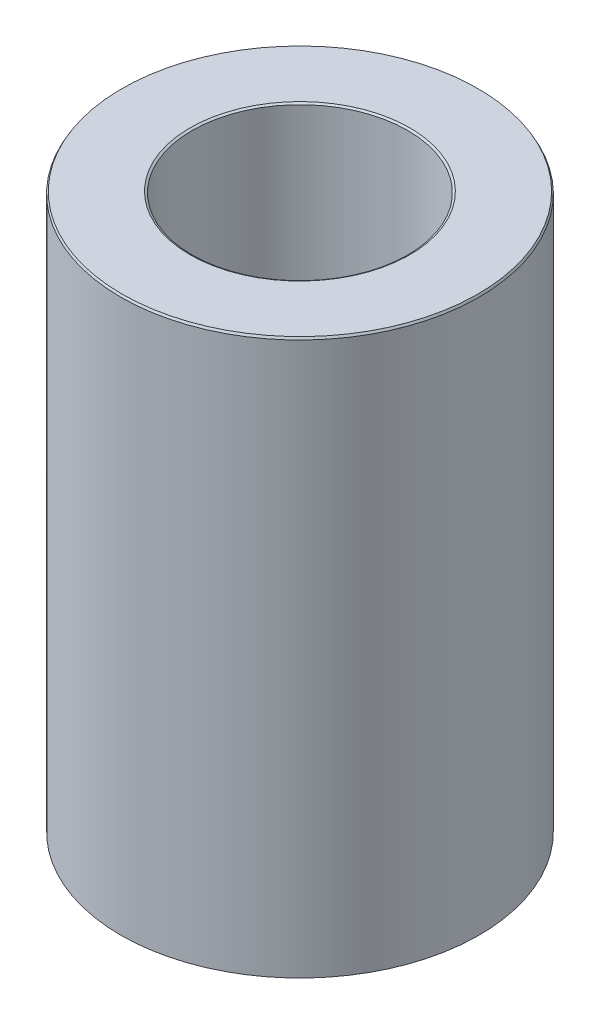
from build123d import *
from OCP.BRepFilletAPI import BRepFilletAPI_MakeChamfer

# Parameters (mm, degrees)
SKETCH1_R           = 25
BOSS_EXTRUDE1_DEPTH = 77.554585152
SKETCH2_R           = 15.04358838
CUT_EXTRUDE1_DEPTH  = 86.23328973
CHAMFER1_SIZE       = 0.293723615
CHAMFER1_SIZE2      = 0.169581408


with BuildPart() as part:
    # Sketch1 → Boss-Extrude1 (new body)
    with BuildSketch(Plane(origin=(0, 0, 0), x_dir=(1, 0, 0), z_dir=(0, 1, 0))):
        Circle(SKETCH1_R)
    extrude(amount=BOSS_EXTRUDE1_DEPTH)

    # Sketch2 → Cut-Extrude1 (cut, through all)
    with BuildSketch(Plane(origin=(0, 0, 0), x_dir=(1, 0, 0), z_dir=(0, 1, 0))):
        Circle(SKETCH2_R)
    extrude(amount=CUT_EXTRUDE1_DEPTH, mode=Mode.SUBTRACT)

    # Chamfer1: one chamfer whose edges measure the first distance from different faces: ONE call of the kernel's chamfer builder (chamfer() names one face for all edges)
    chamfer1_edges_1 = [part.edges().sort_by_distance(p)[0] for p in [
        (-15.04358838, 77.554585152, 0),
    ]]
    chamfer1_side_1 = [part.faces().sort_by_distance(p)[0] for p in [
        (-24.292893219, 77.554585152, 0),
    ]]
    chamfer1_edges_2 = [part.edges().sort_by_distance(p)[0] for p in [
        (-15.04358838, 0, 0),
    ]]
    chamfer1_side_2 = [part.faces().sort_by_distance(p)[0] for p in [
        (-15.04358838, 38.777292576, 0),
    ]]
    chamfer1_edges_3 = [part.edges().sort_by_distance(p)[0] for p in [
        (-25, 0, 0),
    ]]
    chamfer1_side_3 = [part.faces().sort_by_distance(p)[0] for p in [
        (-24.292893219, 0, 0),
    ]]
    chamfer1_edges_4 = [part.edges().sort_by_distance(p)[0] for p in [
        (-25, 77.554585152, 0),
    ]]
    chamfer1_side_4 = [part.faces().sort_by_distance(p)[0] for p in [
        (-25, 38.777292576, 0),
    ]]
    chamfer1 = BRepFilletAPI_MakeChamfer(part.part.solid().wrapped)
    for e in chamfer1_edges_1:
        chamfer1.Add(CHAMFER1_SIZE, CHAMFER1_SIZE2, e.wrapped, chamfer1_side_1[0].wrapped)  # the first distance lies on this face
    for e in chamfer1_edges_2:
        chamfer1.Add(CHAMFER1_SIZE, CHAMFER1_SIZE2, e.wrapped, chamfer1_side_2[0].wrapped)  # the first distance lies on this face
    for e in chamfer1_edges_3:
        chamfer1.Add(CHAMFER1_SIZE, CHAMFER1_SIZE2, e.wrapped, chamfer1_side_3[0].wrapped)  # the first distance lies on this face
    for e in chamfer1_edges_4:
        chamfer1.Add(CHAMFER1_SIZE, CHAMFER1_SIZE2, e.wrapped, chamfer1_side_4[0].wrapped)  # the first distance lies on this face
    add(Compound.cast(chamfer1.Shape()), mode=Mode.REPLACE)


solid = part.part
